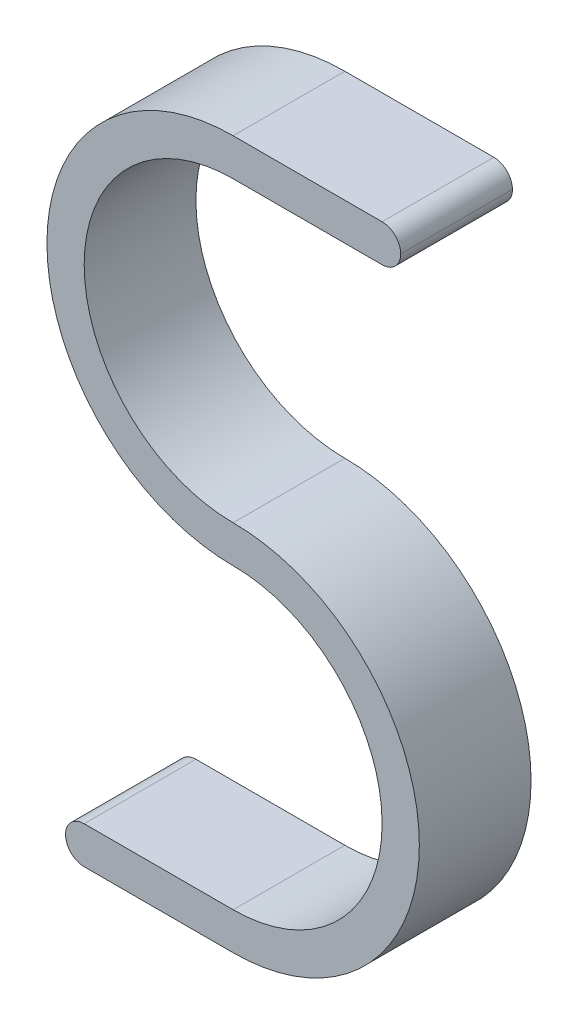
from build123d import *

# Parameters (mm, degrees)
BOSS_EXTRUDE1_DEPTH = 15
FILLET1_R           = 2.5


with BuildPart() as part:
    # Sketch1 → Boss-Extrude1 (new body)
    with BuildSketch(Plane.XY):
        with BuildLine():
            Line((4.569752453, 56.5222889), (27.069752453, 56.5222889))
            Line((27.069752453, 56.5222889), (27.069752453, 51.5222889))
            Line((27.069752453, 51.5222889), (4.569751288, 51.5222889))
            ThreePointArc((4.569751288, 51.5222889), (-15.430247547, 31.522287735), (4.569753619, 11.5222889))
            ThreePointArc((4.569753619, 11.5222889), (29.569753619, -13.4777111), (4.569753619, -38.4777111))
            Line((4.569753619, -38.4777111), (-17.930246381, -38.4777111))
            Line((-17.930246381, -38.4777111), (-17.930246381, -33.4777111))
            Line((-17.930246381, -33.4777111), (4.569753619, -33.4777111))
            ThreePointArc((4.569753619, -33.4777111), (24.569753619, -13.477710841), (4.569753101, 6.5222889))
            ThreePointArc((4.569753101, 6.5222889), (-20.430247547, 31.522288577), (4.569752453, 56.5222889))
        make_face()
    extrude(amount=BOSS_EXTRUDE1_DEPTH)

    # Fillet1
    fillet1_edges = [part.edges().sort_by_distance(p)[0] for p in [
        (-17.930246381, -38.4777111, 7.5),
        (-17.930246381, -33.4777111, 7.5),
        (27.069752453, 51.5222889, 7.5),
        (27.069752453, 56.5222889, 7.5),
    ]]
    fillet(fillet1_edges, radius=FILLET1_R - 0.0001)  # a hair under: the kernel refuses the full size


solid = part.part
